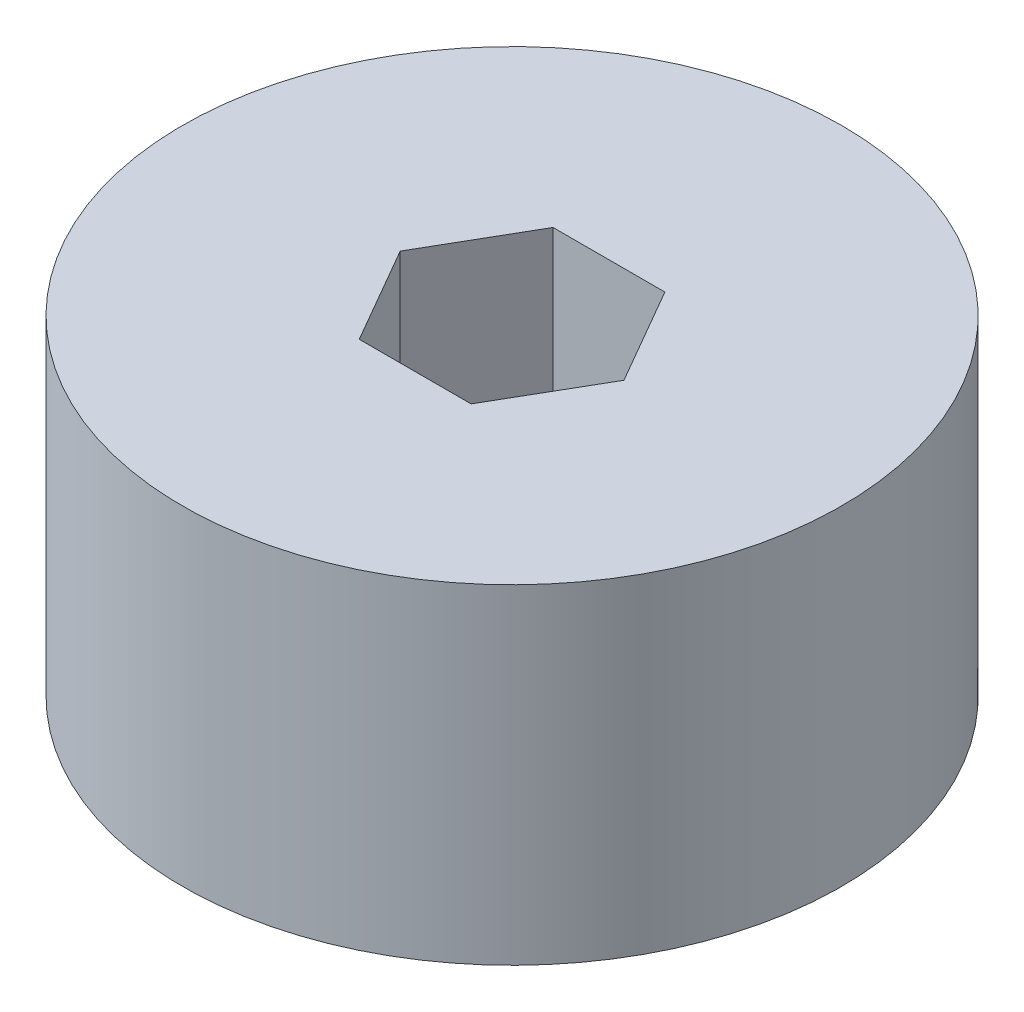
from build123d import *

# Parameters (mm, degrees)
SKETCH1_R           = 4.7625
BOSS_EXTRUDE1_DEPTH = 4.7625
CUT_EXTRUDE1_DEPTH  = 9.248891971


with BuildPart() as part:
    # Sketch1 → Boss-Extrude1 (new body)
    with BuildSketch(Plane(origin=(0, 0, 0), x_dir=(1, 0, 0), z_dir=(0, 1, 0))):
        Circle(SKETCH1_R)
    extrude(amount=BOSS_EXTRUDE1_DEPTH)

    # Sketch2 → Cut-Extrude1 (cut, through all)
    with BuildSketch(Plane.XZ):
        Polygon((0.808290377, 1.4), (-0.808290377, 1.4), (-1.616580754, 0), (-0.808290377, -1.4), (0.808290377, -1.4), (1.616580754, 0), align=None)
    extrude(amount=-CUT_EXTRUDE1_DEPTH, mode=Mode.SUBTRACT)


solid = part.part
